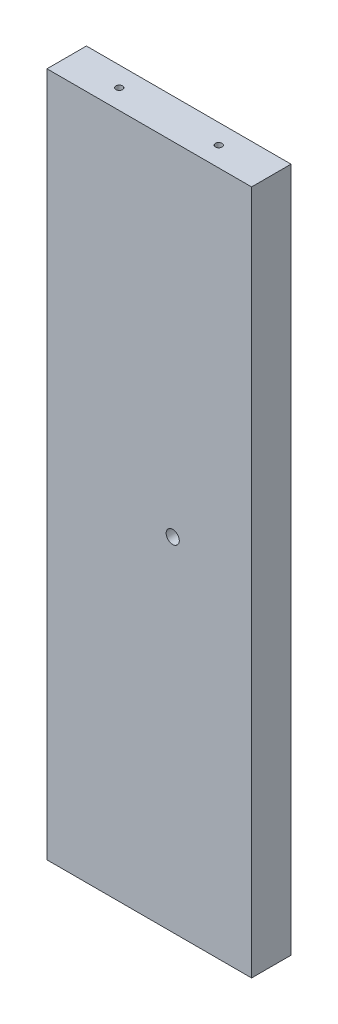
from build123d import *

# Parameters (mm, degrees)
SKETCH1_W                   = 98.843650836
SKETCH1_H                   = 330.949999988
BOSS_EXTRUDE1_DEPTH         = 19.05
HOLE3_D                     = 3.175
HOLE3_DEPTH                 = 38.1
HOLE3_CSINK_D               = 10.16
HOLE3_CSINK_ANGLE           = 82
HOLE3_TIP                   = 0.953866233
F_1_4_0_25_DIAMETER_HOLE1_D = 6.35
HOLE5_D                     = 3.175
HOLE5_DEPTH                 = 38.1
HOLE5_CSINK_D               = 10.16
HOLE5_CSINK_ANGLE           = 82
HOLE5_TIP                   = 0.953866233


with BuildPart() as part:
    # Sketch1 → Boss-Extrude1 (new body)
    with BuildSketch(Plane.XY):
        with Locations((258.774792599, -72.024999997)):
            Rectangle(SKETCH1_W, SKETCH1_H)
    extrude(amount=BOSS_EXTRUDE1_DEPTH)

    # Hole3
    with Locations(Plane(origin=(-181.039434513, 112.499999997, 386.262770337), x_dir=(0.9271838545667855, -1.3196841813264566e-15, -0.37460659341591657), z_dir=(0, 1, 0))):
        with Locations((47.413288654, 127.596711745), (39.315467427, 37.945520226), (403.288916316, 71.764018496), (399.091743996, 25.297013484), (513.561319184, 161.164706775), (558.106616554, 143.167238399), (571.189751829, 175.54913452), (654.969392627, 382.911022042), (526.644454459, 193.546602895), (610.424095257, 400.908490418)):
            CounterSinkHole(HOLE3_D / 2, HOLE3_CSINK_D / 2, depth=HOLE3_DEPTH, counter_sink_angle=HOLE3_CSINK_ANGLE)
            with Locations((0, 0, -(HOLE3_DEPTH + HOLE3_TIP / 2))):  # 118° drill point
                Cone(0, HOLE3_D / 2, HOLE3_TIP, mode=Mode.SUBTRACT)

    # 1/4 (0.25) Diameter Hole1 (through all)
    with Locations(Plane(origin=(0, 0, 0), x_dir=(-1, 0, 0), z_dir=(0, 0, -1))):
        with Locations((-270.096618017, -72.024999997)):
            Hole(F_1_4_0_25_DIAMETER_HOLE1_D / 2)

    # Hole5
    with Locations(Plane(origin=(-181.039434513, 112.499999997, 609.909770337), x_dir=(0.9271838545667913, -6.190403823971236e-15, -0.3746065934159023), z_dir=(0, 1, 0))):
        with Locations((47.413288654, 127.596711745), (39.315467427, 37.945520226), (403.288916316, 71.764018496), (399.091743996, 25.297013484), (513.561319184, 161.164706775), (558.106616554, 143.167238399), (571.189751829, 175.54913452), (654.969392627, 382.911022042), (526.644454459, 193.546602895), (610.424095257, 400.908490418)):
            CounterSinkHole(HOLE5_D / 2, HOLE5_CSINK_D / 2, depth=HOLE5_DEPTH, counter_sink_angle=HOLE5_CSINK_ANGLE)
            with Locations((0, 0, -(HOLE5_DEPTH + HOLE5_TIP / 2))):  # 118° drill point
                Cone(0, HOLE5_D / 2, HOLE5_TIP, mode=Mode.SUBTRACT)


solid = part.part
